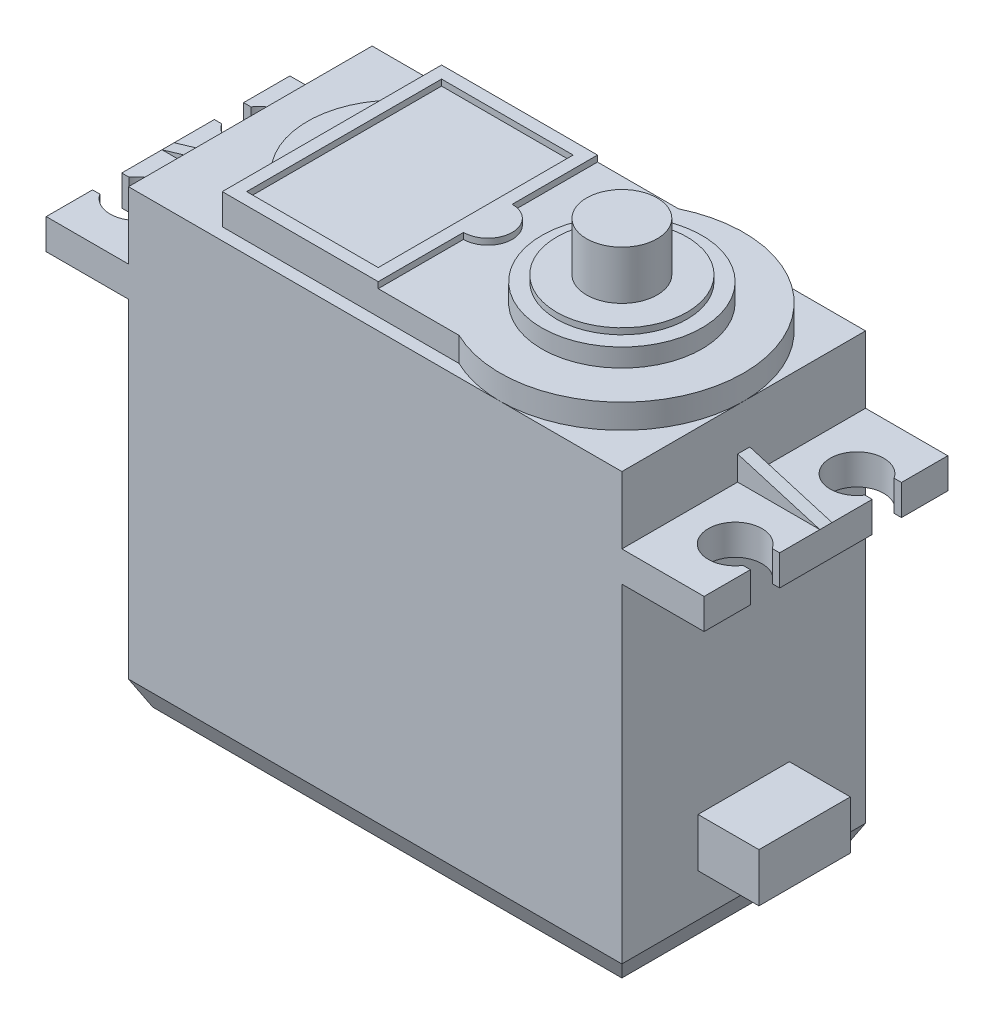
from build123d import *

# Parameters (mm, degrees)
SKETCH_1_W          = 40.5
SKETCH_1_H          = 20
EXTRUDE_1_DEPTH     = 37
EXTRUDE_2_DEPTH     = 2
SKETCH_3_W          = 10.8
SKETCH_3_H          = 16
EXTRUDE_3_DEPTH     = 0.5
SKETCH_4_R          = 6.575
EXTRUDE_4_DEPTH     = 1.5
SKETCH_5_R          = 5.35
EXTRUDE_5_DEPTH     = 0.5
SKETCH_6_R          = 2.9
EXTRUDE_6_DEPTH     = 4
SKETCH_7_W          = 20
SKETCH_7_H          = 2.5
EXTRUDE_7_DEPTH     = 6.75
CUT_EXTRUDE_1_DEPTH = 7
RIB_1_REACH         = 55.423
SKETCH_10_WALL_W    = 115.885747034
SKETCH_10_WALL_H    = 1
SKETCH_13_W         = 7.5
SKETCH_13_H         = 4
EXTRUDE_9_DEPTH     = 5
CHAMFER_1_SIZE      = 1
CHAMFER_1_SIZE2     = 2


with BuildPart() as part:
    # 草图1 → 凸台-拉伸1 (new body)
    with BuildSketch(Plane(origin=(0, 0, 0), x_dir=(1, 0, 0), z_dir=(0, 1, 0))):
        Rectangle(SKETCH_1_W, SKETCH_1_H)
    extrude(amount=EXTRUDE_1_DEPTH)

    # 草图2 → 凸台-拉伸2 (add)
    with BuildSketch(Plane(origin=(0, 37, 0), x_dir=(1, 0, 0), z_dir=(0, 1, 0))):
        with BuildLine():
            Line((-13.55, 9), (5.891101056, 9))
            ThreePointArc((5.891101056, 9), (20.25, 0), (5.891101056, -9))
            Line((5.891101056, -9), (-13.55, -9))
            Line((-13.55, -9), (-13.55, -5))
            ThreePointArc((-13.55, -5), (-15.55, 0), (-13.55, 5))
            Line((-13.55, 5), (-13.55, 9))
        make_face()
    extrude(amount=EXTRUDE_2_DEPTH)

    # 草图3 → 凸台-拉伸3 (add)
    with BuildSketch(Plane(origin=(0, 39, 0), x_dir=(1, 0, 0), z_dir=(0, 1, 0))):
        with BuildLine():
            Line((-13.55, 9), (-0.75, 9))
            Line((-0.75, 9), (-0.75, 2))
            ThreePointArc((-0.75, 2), (1.25, 0), (-0.75, -2))
            Line((-0.75, -2), (-0.75, -9))
            Line((-0.75, -9), (-13.55, -9))
            Line((-13.55, -9), (-13.55, 9))
        make_face()
        with Locations((-7.15, 0)):
            Rectangle(SKETCH_3_W, SKETCH_3_H, mode=Mode.SUBTRACT)
    extrude(amount=EXTRUDE_3_DEPTH)

    # 草图4 → 凸台-拉伸4 (add)
    with BuildSketch(Plane(origin=(0, 39, 0), x_dir=(1, 0, 0), z_dir=(0, 1, 0))):
        with Locations((10.25, 0)):
            Circle(SKETCH_4_R)
    extrude(amount=EXTRUDE_4_DEPTH)

    # 草图5 → 凸台-拉伸5 (add)
    with BuildSketch(Plane(origin=(0, 40.5, 0), x_dir=(1, 0, 0), z_dir=(0, 1, 0))):
        with Locations((10.25, 0)):
            Circle(SKETCH_5_R)
    extrude(amount=EXTRUDE_5_DEPTH)

    # 草图6 → 凸台-拉伸6 (add)
    with BuildSketch(Plane(origin=(0, 41, 0), x_dir=(1, 0, 0), z_dir=(0, 1, 0))):
        with Locations((10.25, 0)):
            Circle(SKETCH_6_R)
    extrude(amount=EXTRUDE_6_DEPTH)

    # 草图7 → 凸台-拉伸7 (add)
    with BuildSketch(Plane.ZY.offset(20.25)):
        with Locations((0, 30.25)):
            Rectangle(SKETCH_7_W, SKETCH_7_H)
    extrude_7 = extrude(amount=EXTRUDE_7_DEPTH)

    # 草图8 → 切除-拉伸1 (cut)
    with BuildSketch(Plane(origin=(0, 31.5, 0), x_dir=(1, 0, 0), z_dir=(0, 1, 0))):
        with BuildLine():
            Line((-27, 6.2), (-26.393908891, 6.2))
            ThreePointArc((-26.393908891, 6.2), (-22.35, 5), (-26.393908891, 3.8))
            Line((-26.393908891, 3.8), (-27, 3.8))
            Line((-27, 3.8), (-27, 6.2))
        make_face()
        with BuildLine():
            Line((-27, -3.8), (-26.393908891, -3.8))
            ThreePointArc((-26.393908891, -3.8), (-22.35, -5), (-26.393908891, -6.2))
            Line((-26.393908891, -6.2), (-27, -6.2))
            Line((-27, -6.2), (-27, -3.8))
        make_face()
    cut_extrude_1 = extrude(amount=-CUT_EXTRUDE_1_DEPTH, mode=Mode.SUBTRACT)

    # 草图10 wall → 筋1 (add, up to next)
    with BuildSketch(Plane(origin=(-23.625, 32.5, 0), x_dir=(-0.958798112708, -0.284088329691, 0), z_dir=(0.284088329691, -0.958798112708, 0)), mode=Mode.PRIVATE) as rib_1_sk1:
        Rectangle(SKETCH_10_WALL_W, SKETCH_10_WALL_H)
    rib_1_tool1 = extrude(rib_1_sk1.sketch, amount=RIB_1_REACH, mode=Mode.PRIVATE) - part.part
    rib_1 = rib_1_tool1.solids().sort_by_distance((-23.625, 32.5, 0))[0]
    add(rib_1)

    # 镜向1: 凸台-拉伸7, 切除-拉伸1, 筋1 across plane
    add(extrude_7.mirror(Plane.ZY))
    add(cut_extrude_1.mirror(Plane.ZY), mode=Mode.SUBTRACT)
    add(rib_1.mirror(Plane.ZY))

    # 草图13 → 凸台-拉伸9 (add)
    with BuildSketch(Plane(origin=(20.25, 0, 0), x_dir=(0, 0, -1), z_dir=(1, 0, 0))):
        with Locations((0, 7.5)):
            Rectangle(SKETCH_13_W, SKETCH_13_H)
    extrude(amount=EXTRUDE_9_DEPTH)

    # 倒角1
    chamfer_1_edges = [part.edges().sort_by_distance(p)[0] for p in [
        (20.25, 0, 0),
        (0, 0, 10),
        (-20.25, 0, 0),
        (0, 0, -10),
    ]]
    chamfer_1_side = [part.faces().sort_by_distance(p)[0] for p in [
        (0, 0, 0),
    ]]
    chamfer(chamfer_1_edges, length=CHAMFER_1_SIZE, length2=CHAMFER_1_SIZE2, reference=chamfer_1_side[0])


solid = part.part
